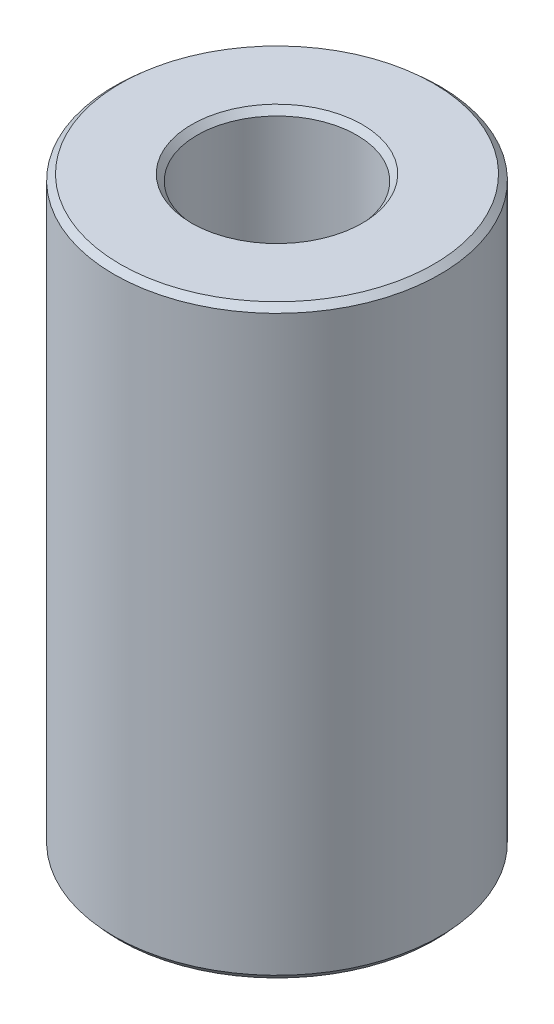
from build123d import *
from OCP.BRepFilletAPI import BRepFilletAPI_MakeChamfer

# Parameters (mm, degrees)
SKETCH1_R           = 47.5
BOSS_EXTRUDE1_DEPTH = 170.591020045
SKETCH2_R           = 23.262609878
CUT_EXTRUDE1_DEPTH  = 184.340655938
CHAMFER1_SIZE       = 1.636098457
CHAMFER1_SIZE2      = 1.831811456


with BuildPart() as part:
    # Sketch1 → Boss-Extrude1 (new body)
    with BuildSketch(Plane(origin=(0, 0, 0), x_dir=(1, 0, 0), z_dir=(0, 1, 0))):
        Circle(SKETCH1_R)
    extrude(amount=BOSS_EXTRUDE1_DEPTH)

    # Sketch2 → Cut-Extrude1 (cut, through all)
    with BuildSketch(Plane(origin=(0, 0, 0), x_dir=(1, 0, 0), z_dir=(0, 1, 0))):
        Circle(SKETCH2_R)
    extrude(amount=CUT_EXTRUDE1_DEPTH, mode=Mode.SUBTRACT)

    # Chamfer1: one chamfer whose edges measure the first distance from different faces: ONE call of the kernel's chamfer builder (chamfer() names one face for all edges)
    chamfer1_edges_1 = [part.edges().sort_by_distance(p)[0] for p in [
        (-23.262609878, 170.591020045, 0),
    ]]
    chamfer1_side_1 = [part.faces().sort_by_distance(p)[0] for p in [
        (-46.156497116, 170.591020045, 0),
    ]]
    chamfer1_edges_2 = [part.edges().sort_by_distance(p)[0] for p in [
        (-23.262609878, 0, 0),
    ]]
    chamfer1_side_2 = [part.faces().sort_by_distance(p)[0] for p in [
        (-23.262609878, 85.295510022, 0),
    ]]
    chamfer1_edges_3 = [part.edges().sort_by_distance(p)[0] for p in [
        (-47.5, 0, 0),
    ]]
    chamfer1_side_3 = [part.faces().sort_by_distance(p)[0] for p in [
        (-46.156497116, 0, 0),
    ]]
    chamfer1_edges_4 = [part.edges().sort_by_distance(p)[0] for p in [
        (-47.5, 170.591020045, 0),
    ]]
    chamfer1_side_4 = [part.faces().sort_by_distance(p)[0] for p in [
        (-47.5, 85.295510022, 0),
    ]]
    chamfer1 = BRepFilletAPI_MakeChamfer(part.part.solid().wrapped)
    for e in chamfer1_edges_1:
        chamfer1.Add(CHAMFER1_SIZE, CHAMFER1_SIZE2, e.wrapped, chamfer1_side_1[0].wrapped)  # the first distance lies on this face
    for e in chamfer1_edges_2:
        chamfer1.Add(CHAMFER1_SIZE, CHAMFER1_SIZE2, e.wrapped, chamfer1_side_2[0].wrapped)  # the first distance lies on this face
    for e in chamfer1_edges_3:
        chamfer1.Add(CHAMFER1_SIZE, CHAMFER1_SIZE2, e.wrapped, chamfer1_side_3[0].wrapped)  # the first distance lies on this face
    for e in chamfer1_edges_4:
        chamfer1.Add(CHAMFER1_SIZE, CHAMFER1_SIZE2, e.wrapped, chamfer1_side_4[0].wrapped)  # the first distance lies on this face
    add(Compound.cast(chamfer1.Shape()), mode=Mode.REPLACE)


solid = part.part
